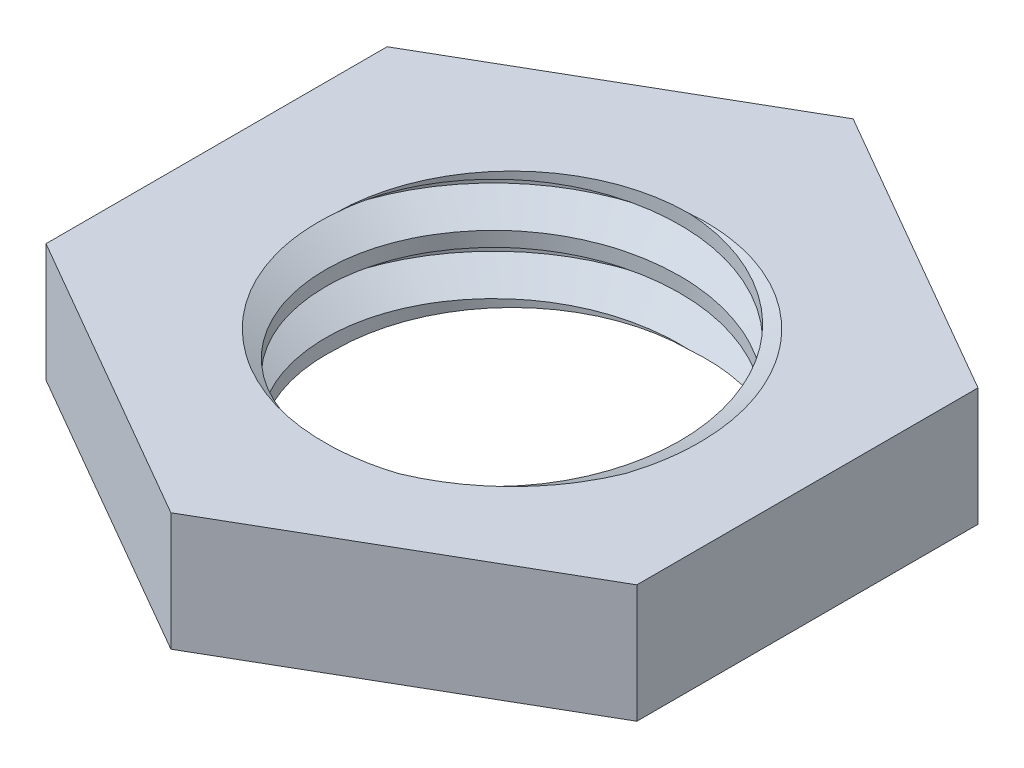
from build123d import *

# Parameters (mm, degrees)
SKETCH_1_R      = 2.5
EXTRUDE_1_DEPTH = 2
M7X1_02_D       = 6
M7X1_02_DEPTH   = 10
M7X1_02_TIP     = 1.802581857
THREAD_2_PITCH  = 1


with BuildPart() as part:
    # Эскиз1 → Бобышка-Вытянуть1 (new body)
    with BuildSketch(Plane(origin=(0, 0, 0), x_dir=(1, 0, 0), z_dir=(0, 1, 0))):
        Polygon((-5, -2.886751346), (-5, 2.886751346), (0, 5.773502692), (5, 2.886751346), (5, -2.886751346), (0, -5.773502692), align=None)
        with Locations(Location((0, 0, 0), (0, 0, 270))):
            Circle(SKETCH_1_R, mode=Mode.SUBTRACT)
    extrude(amount=EXTRUDE_1_DEPTH)

    # Сверление под метчик M7x1.02
    with Locations(Plane(origin=(0, 2, 0), x_dir=(1, 0, 0), z_dir=(0, 1, 0))):
        with Locations((0, 0)):
            Hole(M7X1_02_D / 2, depth=M7X1_02_DEPTH)
            with Locations((0, 0, -(M7X1_02_DEPTH + M7X1_02_TIP / 2))):  # 118° drill point
                Cone(0, M7X1_02_D / 2, M7X1_02_TIP, mode=Mode.SUBTRACT)

    # Резьба2: the profile of Профиль резьбы2 profile screwed along a right-hand helix of 5 turns, 8 arcs to a turn; built about Z, then put on its axis
    thread_2_z = Axis((0, 0, 0), (0, 0, 1))
    thread_2_corners = [(2.9997, 0, -0.000173205), (3.541265875, 0, 0.312499999), (3.541265875, 0, 0.437499999), (2.9997, 0, 0.750173202)]
    with BuildLine(mode=Mode.PRIVATE) as thread_2_profile:
        Line(thread_2_corners[0], thread_2_corners[1])
        Line(thread_2_corners[1], thread_2_corners[2])
        Line(thread_2_corners[2], thread_2_corners[3])
        Line(thread_2_corners[3], thread_2_corners[0])
    thread_2_cap = Face(thread_2_profile.wire())
    thread_2_turn_angles = [0, 22.5, 45, 67.5, 90, 112.5, 135, 157.5, 180, 202.5, 225, 247.5, 270, 292.5, 315, 337.5, 360]
    thread_2_turn_weights = [1, 0.9238795325112867, 1, 0.9238795325112867, 1, 0.9238795325112867, 1, 0.9238795325112867, 1, 0.9238795325112867, 1, 0.9238795325112867, 1, 0.9238795325112867, 1, 0.9238795325112867, 1]
    thread_2_turn_rails = [Edge.make_bspline([Vector(p[0], p[1], 0).rotate(thread_2_z, thread_2_turn_angles[k]) / thread_2_turn_weights[k] + Vector(0, 0, p[2] + THREAD_2_PITCH * thread_2_turn_angles[k] / 360) for k in range(17)], [0, 0, 0, 1, 1, 2, 2, 3, 3, 4, 4, 5, 5, 6, 6, 7, 7, 8, 8, 8], 2, thread_2_turn_weights) for p in thread_2_corners]
    thread_2_turn_sides = [Face.make_surface_from_curves(thread_2_turn_rails[p[0]], thread_2_turn_rails[p[1]]) for p in [(0, 1), (1, 2), (2, 3), (3, 0)]]
    thread_2 = Plane(origin=(0, 3, 0), x_dir=(-1, 0, 0), z_dir=(0, -1, 0)) * Solid(Shell([*[p.moved(Location((0, 0, THREAD_2_PITCH * i))) for i in range(5) for p in thread_2_turn_sides], thread_2_cap, thread_2_cap.rotate(thread_2_z, 1800).moved(Location((0, 0, THREAD_2_PITCH * 1800 / 360)))]))
    add(thread_2, mode=Mode.SUBTRACT)


solid = part.part
